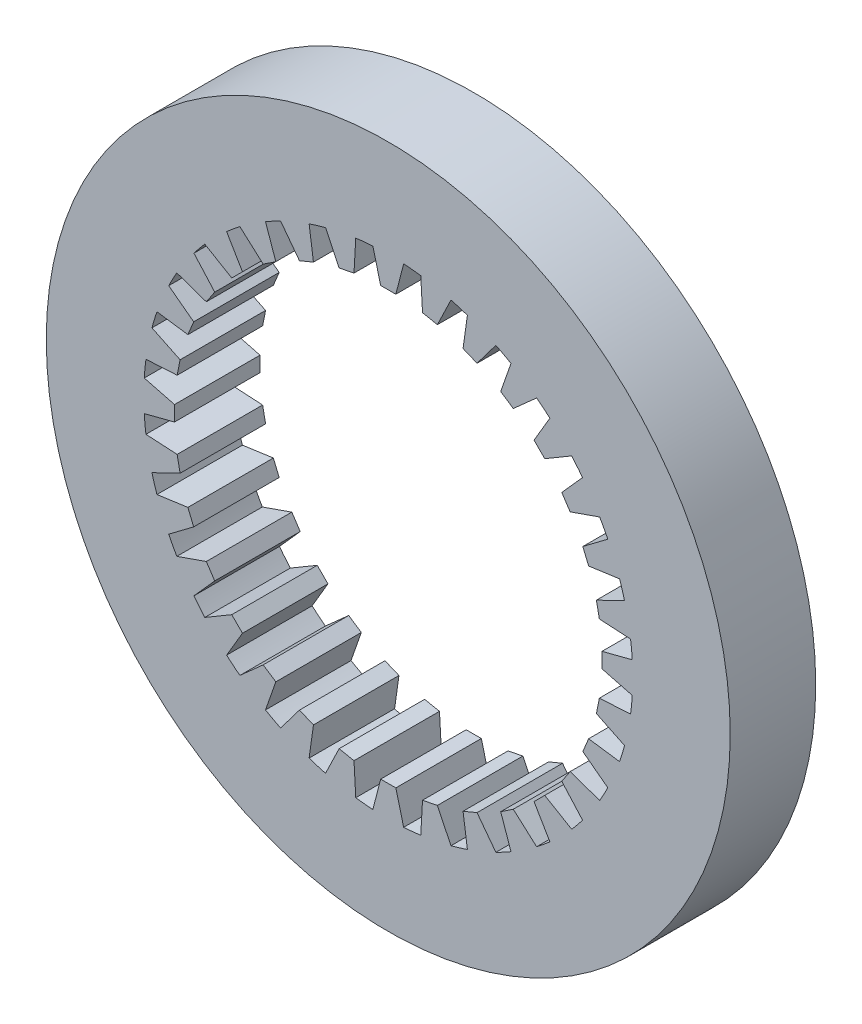
from build123d import *

# Parameters (mm, degrees)
SKETCH1_R           = 19.05
BOSS_EXTRUDE1_DEPTH = 4.7625


# Read off the part's stored shape, not the designer's step: Imported1
with BuildPart() as part:
    # Sketch1 → Boss-Extrude1 (new body)
    with BuildSketch(Plane.XY.offset(2.38125)):
        with Locations(Location((0, 0, 0), (0, 0, 180))):
            Circle(SKETCH1_R)
        with BuildLine():
            Line((1.908812995, 11.759820716), (1.810138608, 13.497531825))
            ThreePointArc((1.810138608, 13.497531825), (1.334833561, 13.552792572), (0.857880531, 13.591321069))
            Line((0.857880531, 13.591321069), (0.422091522, 11.90625))
            Line((0.422091522, 11.90625), (-0.422091522, 11.90625))
            Line((-0.422091522, 11.90625), (-0.857880531, 13.591321069))
            ThreePointArc((-0.857880531, 13.591321069), (-1.334833561, 13.552792582), (-1.810138607, 13.497531835))
            Line((-1.810138607, 13.497531835), (-1.908812995, 11.759820716))
            Line((-1.908812995, 11.759820716), (-2.736775298, 11.595128774))
            Line((-2.736775298, 11.595128774), (-3.492931801, 13.162803457))
            ThreePointArc((-3.492931801, 13.162803457), (-3.953203777, 13.031966364), (-4.408595133, 12.885040022))
            Line((-4.408595133, 12.885040022), (-4.166362899, 11.161468116))
            Line((-4.166362899, 11.161468116), (-4.946286334, 10.838413252))
            Line((-4.946286334, 10.838413252), (-5.993751661, 12.228446689))
            ThreePointArc((-5.993751661, 12.228446689), (-6.41965459, 12.010328986), (-6.837631821, 11.777383347))
            Line((-6.837631821, 11.777383347), (-6.263801813, 10.134186556))
            Line((-6.263801813, 10.134186556), (-6.965714361, 9.665183587))
            Line((-6.965714361, 9.665183587), (-8.264235006, 10.824157574))
            ThreePointArc((-8.264235006, 10.824157574), (-8.639401676, 10.527141401), (-9.003902152, 10.217128434))
            Line((-9.003902152, 10.217128434), (-8.120526336, 8.717453891))
            Line((-8.120526336, 8.717453891), (-8.717453891, 8.120526336))
            Line((-8.717453891, 8.120526336), (-10.217128434, 9.003902152))
            ThreePointArc((-10.217128434, 9.003902152), (-10.527141401, 8.639401676), (-10.824157574, 8.264235006))
            Line((-10.824157574, 8.264235006), (-9.665183587, 6.965714361))
            Line((-9.665183587, 6.965714361), (-10.134186556, 6.263801813))
            Line((-10.134186556, 6.263801813), (-11.777383347, 6.837631821))
            ThreePointArc((-11.777383347, 6.837631821), (-12.010328986, 6.41965459), (-12.228446689, 5.993751661))
            Line((-12.228446689, 5.993751661), (-10.838413252, 4.946286334))
            Line((-10.838413252, 4.946286334), (-11.161468116, 4.166362899))
            Line((-11.161468116, 4.166362899), (-12.885040022, 4.408595133))
            ThreePointArc((-12.885040022, 4.408595133), (-13.031966364, 3.953203777), (-13.162803457, 3.492931801))
            Line((-13.162803457, 3.492931801), (-11.595128774, 2.736775298))
            Line((-11.595128774, 2.736775298), (-11.759820716, 1.908812995))
            Line((-11.759820716, 1.908812995), (-13.497531835, 1.810138607))
            ThreePointArc((-13.497531835, 1.810138607), (-13.552792582, 1.334833561), (-13.591321069, 0.857880531))
            Line((-13.591321069, 0.857880531), (-11.90625, 0.422091522))
            Line((-11.90625, 0.422091522), (-11.90625, -0.422091522))
            Line((-11.90625, -0.422091522), (-13.591321069, -0.857880531))
            ThreePointArc((-13.591321069, -0.857880531), (-13.552792582, -1.334833561), (-13.497531835, -1.810138607))
            Line((-13.497531835, -1.810138607), (-11.759820716, -1.908812995))
            Line((-11.759820716, -1.908812995), (-11.595128774, -2.736775298))
            Line((-11.595128774, -2.736775298), (-13.162803457, -3.492931801))
            ThreePointArc((-13.162803457, -3.492931801), (-13.031966364, -3.953203777), (-12.885040022, -4.408595133))
            Line((-12.885040022, -4.408595133), (-11.161468116, -4.166362899))
            Line((-11.161468116, -4.166362899), (-10.838413252, -4.946286334))
            Line((-10.838413252, -4.946286334), (-12.228446689, -5.993751661))
            ThreePointArc((-12.228446689, -5.993751661), (-12.010328986, -6.41965459), (-11.777383347, -6.837631821))
            Line((-11.777383347, -6.837631821), (-10.134186556, -6.263801813))
            Line((-10.134186556, -6.263801813), (-9.665183587, -6.965714361))
            Line((-9.665183587, -6.965714361), (-10.824157574, -8.264235006))
            ThreePointArc((-10.824157574, -8.264235006), (-10.527141401, -8.639401676), (-10.217128434, -9.003902152))
            Line((-10.217128434, -9.003902152), (-8.717453891, -8.120526336))
            Line((-8.717453891, -8.120526336), (-8.120526336, -8.717453891))
            Line((-8.120526336, -8.717453891), (-9.003902152, -10.217128434))
            ThreePointArc((-9.003902152, -10.217128434), (-8.639401676, -10.527141401), (-8.264235006, -10.824157574))
            Line((-8.264235006, -10.824157574), (-6.965714361, -9.665183587))
            Line((-6.965714361, -9.665183587), (-6.263801813, -10.134186556))
            Line((-6.263801813, -10.134186556), (-6.837631821, -11.777383347))
            ThreePointArc((-6.837631821, -11.777383347), (-6.41965459, -12.010328986), (-5.993751661, -12.228446689))
            Line((-5.993751661, -12.228446689), (-4.946286334, -10.838413252))
            Line((-4.946286334, -10.838413252), (-4.166362899, -11.161468116))
            Line((-4.166362899, -11.161468116), (-4.408595133, -12.885040022))
            ThreePointArc((-4.408595133, -12.885040022), (-3.953203777, -13.031966364), (-3.492931801, -13.162803457))
            Line((-3.492931801, -13.162803457), (-2.736775298, -11.595128774))
            Line((-2.736775298, -11.595128774), (-1.908812995, -11.759820716))
            Line((-1.908812995, -11.759820716), (-1.810138607, -13.497531835))
            ThreePointArc((-1.810138607, -13.497531835), (-1.334833561, -13.552792582), (-0.857880531, -13.591321069))
            Line((-0.857880531, -13.591321069), (-0.422091522, -11.90625))
            Line((-0.422091522, -11.90625), (0.422091522, -11.90625))
            Line((0.422091522, -11.90625), (0.857880531, -13.591321069))
            ThreePointArc((0.857880531, -13.591321069), (1.334833561, -13.552792582), (1.810138607, -13.497531835))
            Line((1.810138607, -13.497531835), (1.908812995, -11.759820716))
            Line((1.908812995, -11.759820716), (2.736775298, -11.595128774))
            Line((2.736775298, -11.595128774), (3.492931801, -13.162803457))
            ThreePointArc((3.492931801, -13.162803457), (3.953203777, -13.031966364), (4.408595133, -12.885040022))
            Line((4.408595133, -12.885040022), (4.166362899, -11.161468116))
            Line((4.166362899, -11.161468116), (4.946286334, -10.838413252))
            Line((4.946286334, -10.838413252), (5.993751661, -12.228446689))
            ThreePointArc((5.993751661, -12.228446689), (6.41965459, -12.010328986), (6.837631821, -11.777383347))
            Line((6.837631821, -11.777383347), (6.263801813, -10.134186556))
            Line((6.263801813, -10.134186556), (6.965714361, -9.665183587))
            Line((6.965714361, -9.665183587), (8.264235006, -10.824157574))
            ThreePointArc((8.264235006, -10.824157574), (8.639401676, -10.527141401), (9.003902152, -10.217128434))
            Line((9.003902152, -10.217128434), (8.120526336, -8.717453891))
            Line((8.120526336, -8.717453891), (8.717453891, -8.120526336))
            Line((8.717453891, -8.120526336), (10.217128434, -9.003902152))
            ThreePointArc((10.217128434, -9.003902152), (10.527141401, -8.639401676), (10.824157574, -8.264235006))
            Line((10.824157574, -8.264235006), (9.665183587, -6.965714361))
            Line((9.665183587, -6.965714361), (10.134186556, -6.263801813))
            Line((10.134186556, -6.263801813), (11.777383347, -6.837631821))
            ThreePointArc((11.777383347, -6.837631821), (12.010328986, -6.41965459), (12.228446689, -5.993751661))
            Line((12.228446689, -5.993751661), (10.838413252, -4.946286334))
            Line((10.838413252, -4.946286334), (11.161468116, -4.166362899))
            Line((11.161468116, -4.166362899), (12.885040022, -4.408595133))
            ThreePointArc((12.885040022, -4.408595133), (13.031966364, -3.953203777), (13.162803457, -3.492931801))
            Line((13.162803457, -3.492931801), (11.595128774, -2.736775298))
            Line((11.595128774, -2.736775298), (11.759820716, -1.908812995))
            Line((11.759820716, -1.908812995), (13.497531835, -1.810138607))
            ThreePointArc((13.497531835, -1.810138607), (13.552792582, -1.334833561), (13.591321069, -0.857880531))
            Line((13.591321069, -0.857880531), (11.90625, -0.422091522))
            Line((11.90625, -0.422091522), (11.90625, 0.422091522))
            Line((11.90625, 0.422091522), (13.591321069, 0.857880531))
            ThreePointArc((13.591321069, 0.857880531), (13.552792582, 1.334833561), (13.497531835, 1.810138607))
            Line((13.497531835, 1.810138607), (11.759820716, 1.908812995))
            Line((11.759820716, 1.908812995), (11.595128774, 2.736775298))
            Line((11.595128774, 2.736775298), (13.162803457, 3.492931801))
            ThreePointArc((13.162803457, 3.492931801), (13.031966364, 3.953203777), (12.885040022, 4.408595133))
            Line((12.885040022, 4.408595133), (11.161468116, 4.166362899))
            Line((11.161468116, 4.166362899), (10.838413252, 4.946286334))
            Line((10.838413252, 4.946286334), (12.228446689, 5.993751661))
            ThreePointArc((12.228446689, 5.993751661), (12.010328986, 6.41965459), (11.777383347, 6.837631821))
            Line((11.777383347, 6.837631821), (10.134186556, 6.263801813))
            Line((10.134186556, 6.263801813), (9.665183587, 6.965714361))
            Line((9.665183587, 6.965714361), (10.824157574, 8.264235006))
            ThreePointArc((10.824157574, 8.264235006), (10.527141401, 8.639401676), (10.217128434, 9.003902152))
            Line((10.217128434, 9.003902152), (8.717453891, 8.120526336))
            Line((8.717453891, 8.120526336), (8.120526336, 8.717453891))
            Line((8.120526336, 8.717453891), (9.003902152, 10.217128434))
            ThreePointArc((9.003902152, 10.217128434), (8.639401676, 10.527141401), (8.264235006, 10.824157574))
            Line((8.264235006, 10.824157574), (6.965714361, 9.665183587))
            Line((6.965714361, 9.665183587), (6.263801813, 10.134186556))
            Line((6.263801813, 10.134186556), (6.837631821, 11.777383347))
            ThreePointArc((6.837631821, 11.777383347), (6.41965459, 12.010328986), (5.993751661, 12.228446689))
            Line((5.993751661, 12.228446689), (4.946286334, 10.838413252))
            Line((4.946286334, 10.838413252), (4.166362899, 11.161468116))
            Line((4.166362899, 11.161468116), (4.408595133, 12.885040022))
            ThreePointArc((4.408595133, 12.885040022), (3.953203777, 13.031966364), (3.492931801, 13.162803457))
            Line((3.492931801, 13.162803457), (2.736775298, 11.595128774))
            Line((2.736775298, 11.595128774), (1.908812995, 11.759820716))
        make_face(mode=Mode.SUBTRACT)
    extrude(amount=-BOSS_EXTRUDE1_DEPTH)


solid = part.part
